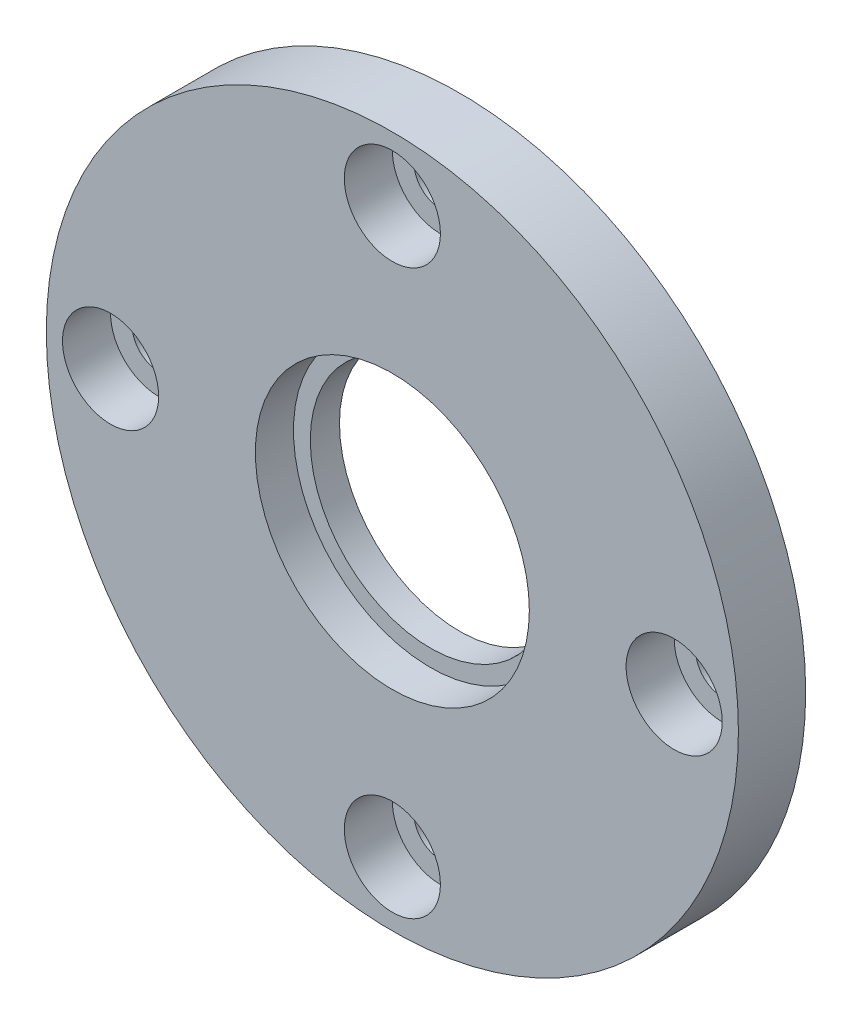
from build123d import *

# Parameters (mm, degrees)
SKETCH1_W                      = 7
SKETCH1_H                      = 26.5
SKETCH2_R                      = 12.5
SHAFT_THRU_DEPTH               = 52.39066063
CBORE_FOR_M5_SHCS1_D           = 5.5
CBORE_FOR_M5_SHCS1_CBORE_D     = 10
CBORE_FOR_M5_SHCS1_CBORE_DEPTH = 5
CIRPATTERN1_COUNT              = 4
SKETCH5_R                      = 14.25
SEAL_SEAT_DEPTH                = 3.9624


with BuildPart() as part:
    # Sketch1 → Main_body (revolve)
    with BuildSketch(Plane(origin=(0, 0, 0), x_dir=(0, 0, -1), z_dir=(1, 0, 0))):
        with Locations((-137.159, 22.75)):
            Rectangle(SKETCH1_W, SKETCH1_H)
    revolve(axis=Axis((0, 0, 1000), (0, 0, -1)))

    # Sketch2 → Shaft_thru (cut, through all)
    with BuildSketch(Plane(origin=(0, 0, 133.659), x_dir=(-1, 0, 0), z_dir=(0, 0, -1))):
        Circle(SKETCH2_R)
    extrude(amount=-SHAFT_THRU_DEPTH, mode=Mode.SUBTRACT)

    # CBORE for M5 SHCS1 (through all)
    with Locations(Plane.XY.offset(140.659)):
        with Locations((0, 29.3156)):
            cbore_for_m5_shcs1 = CounterBoreHole(CBORE_FOR_M5_SHCS1_D / 2, CBORE_FOR_M5_SHCS1_CBORE_D / 2, CBORE_FOR_M5_SHCS1_CBORE_DEPTH)

    # CirPattern1: CBORE for M5 SHCS1 ×4 about axis
    cirpattern1_axis = Axis((0, 0, 1000), (0, 0, -1))
    for i in range(1, CIRPATTERN1_COUNT):
        add(cbore_for_m5_shcs1.rotate(cirpattern1_axis, i * 360 / CIRPATTERN1_COUNT), mode=Mode.SUBTRACT)

    # Sketch5 → seal_seat (cut)
    with BuildSketch(Plane.XY.offset(140.659)):
        Circle(SKETCH5_R)
    extrude(amount=-SEAL_SEAT_DEPTH, mode=Mode.SUBTRACT)


solid = part.part
